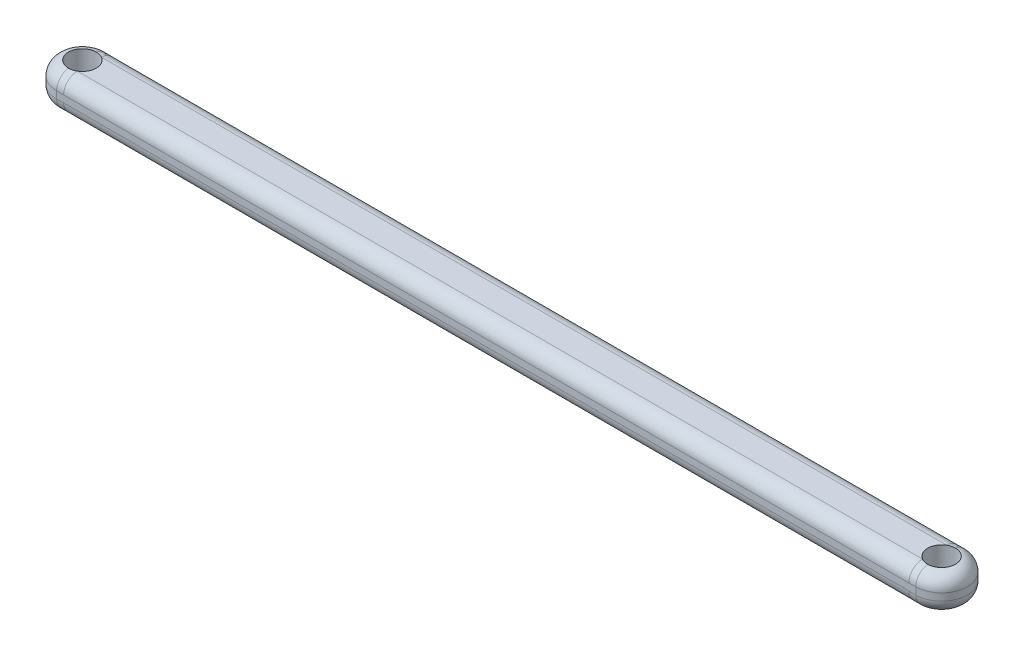
from build123d import *

# Parameters (mm, degrees)
CROQUIS1_R              = 4.05
SALIENTE_EXTRUIR1_DEPTH = 5
REDONDEO6_R             = 4


with BuildPart() as part:
    # Croquis1 → Saliente-Extruir1 (new, symmetric)
    with BuildSketch(Plane(origin=(0, 0, 0), x_dir=(-1, 0, 0), z_dir=(0, 1, 0))):
        with BuildLine():
            Line((0, -7.5), (250, -7.5))
            ThreePointArc((250, -7.5), (257.5, 0), (250, 7.5))
            Line((250, 7.5), (0, 7.5))
            ThreePointArc((0, 7.5), (-7.5, 0), (0, -7.5))
        make_face()
        Circle(CROQUIS1_R, mode=Mode.SUBTRACT)
        with Locations((250, 0)):
            Circle(CROQUIS1_R, mode=Mode.SUBTRACT)
    extrude(amount=SALIENTE_EXTRUIR1_DEPTH, both=True)

    # Redondeo6
    redondeo6_edges = [part.edges().sort_by_distance(p)[0] for p in [
        (-257.5, 5, 0),
        (-257.5, -5, 0),
        (-125, 5, 7.5),
        (-125, -5, 7.5),
        (7.5, 5, 0),
        (7.5, -5, 0),
        (-125, 5, -7.5),
        (-125, -5, -7.5),
    ]]
    fillet(redondeo6_edges, radius=REDONDEO6_R)


solid = part.part
